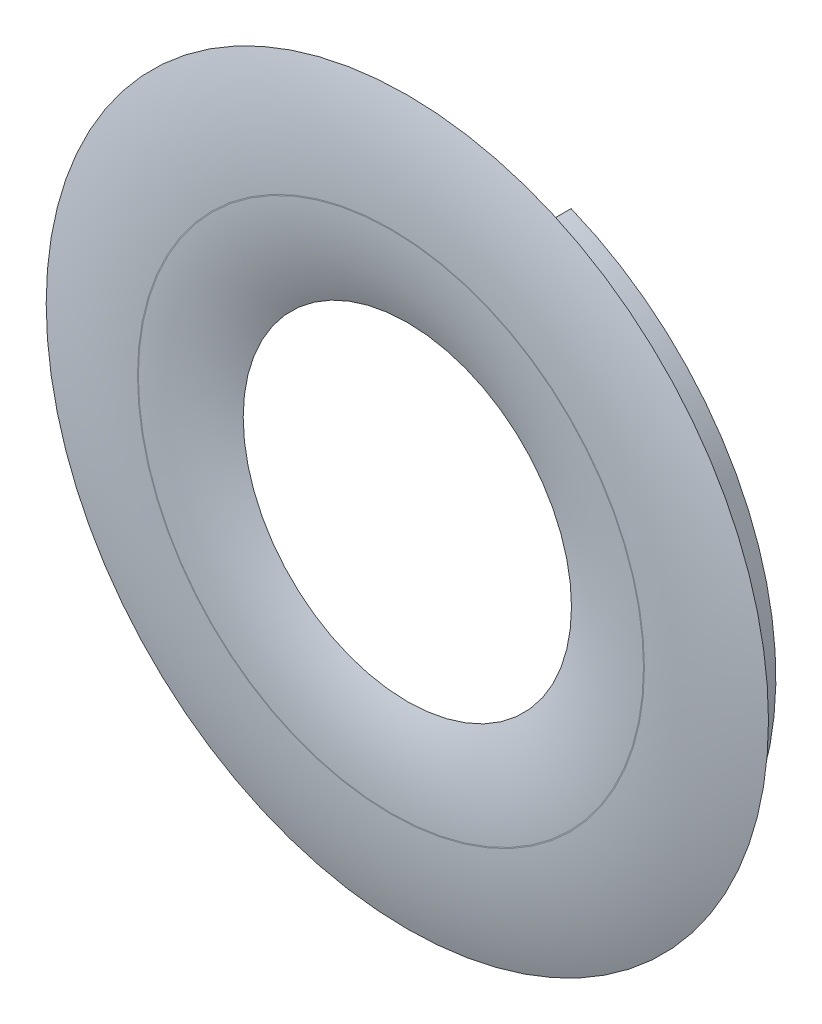
from build123d import *

# Parameters (mm, degrees)
SKETCH3_R           = 22
BOSS_EXTRUDE1_DEPTH = 1
SKETCH7_R           = 10
CUT_EXTRUDE1_DEPTH  = 10
FILLET7_R           = 22
FILLET8_R           = 15
SKETCH8_R           = 19.95
BOSS_EXTRUDE2_DEPTH = 2.5
SKETCH9_R           = 19.2
CUT_EXTRUDE2_DEPTH  = 2.5
SKETCH10_W          = 15
SKETCH10_H          = 3
CUT_EXTRUDE3_DEPTH  = 3
FILLET9_R           = 1


with BuildPart() as part:
    # Sketch3 → Boss-Extrude1 (new body)
    with BuildSketch(Plane.XY):
        Circle(SKETCH3_R)
    extrude(amount=BOSS_EXTRUDE1_DEPTH)

    # Sketch7 → Cut-Extrude1 (cut)
    with BuildSketch(Plane.XY.offset(1)):
        Circle(SKETCH7_R)
    extrude(amount=-CUT_EXTRUDE1_DEPTH, mode=Mode.SUBTRACT)

    # Fillet7
    # the kernel refuses this fillet: 22 mm, written as the material it takes off along each edge
    with BuildSketch(Plane(origin=(0, 0, 1), x_dir=(1, 0, 0), z_dir=(0, -1, 0))) as fillet7_piece_1:
        with BuildLine():
            CenterArc((15.442561476, -22), FILLET7_R, 72.658557197, 17.341442803)
            Line((15.442561476, 0), (15.442561476, 0.44))
            Line((15.442561476, 0.44), (22, 0.44))
            Line((22, 0.44), (22.44, 0))
            ThreePointArc((22.44, 0), (22.44, -0.5), (22.13114877, -0.58))
            Line((22.13114877, -0.58), (22, -1))
        make_face()
    revolve(axis=Axis((0, 0, 1), (0, 0, 1)), mode=Mode.SUBTRACT)

    # Fillet8
    # the kernel refuses this fillet: 15 mm, written as the material it takes off along each edge
    with BuildSketch(Plane(origin=(0, 0, 1), x_dir=(1, 0, 0), z_dir=(0, -1, 0))) as fillet8_piece_1:
        with BuildLine():
            CenterArc((15.385164807, -15), FILLET8_R, 90, 21.039469781)
            Line((15.385164807, 0), (15.385164807, 0.3))
            Line((15.385164807, 0.3), (10, 0.3))
            Line((10, 0.3), (9.7, 0))
            ThreePointArc((9.7, 0), (9.7, -0.5), (9.892296704, -0.72))
            Line((9.892296704, -0.72), (10, -1))
        make_face()
    revolve(axis=Axis((0, 0, 1), (0, 0, 1)), mode=Mode.SUBTRACT)

    # Sketch8 → Boss-Extrude2 (add)
    with BuildSketch(Plane(origin=(0, 0, 0), x_dir=(-1, 0, 0), z_dir=(0, 0, -1))):
        with Locations(Location((0, 0, 0), (0, 0, 180))):
            Circle(SKETCH8_R)
    extrude(amount=BOSS_EXTRUDE2_DEPTH)

    # Sketch9 → Cut-Extrude2 (cut)
    with BuildSketch(Plane(origin=(0, 0, -2.5), x_dir=(-1, 0, 0), z_dir=(0, 0, -1))):
        Circle(SKETCH9_R)
    extrude(amount=-CUT_EXTRUDE2_DEPTH, mode=Mode.SUBTRACT)

    # Sketch10 → Cut-Extrude3 (cut)
    with BuildSketch(Plane(origin=(0, 0, 0), x_dir=(-1, 0, 0), z_dir=(0, 0, -1))):
        with Locations((0.023386831, 18.796449373)):
            Rectangle(SKETCH10_W, SKETCH10_H)
    extrude(amount=CUT_EXTRUDE3_DEPTH, mode=Mode.SUBTRACT)

    # Fillet9
    fillet9_edges = [part.edges().sort_by_distance(p)[0] for p in [
        (0.025405287, -19.199983192, 0),
    ]]
    fillet(fillet9_edges, radius=FILLET9_R)


solid = part.part
